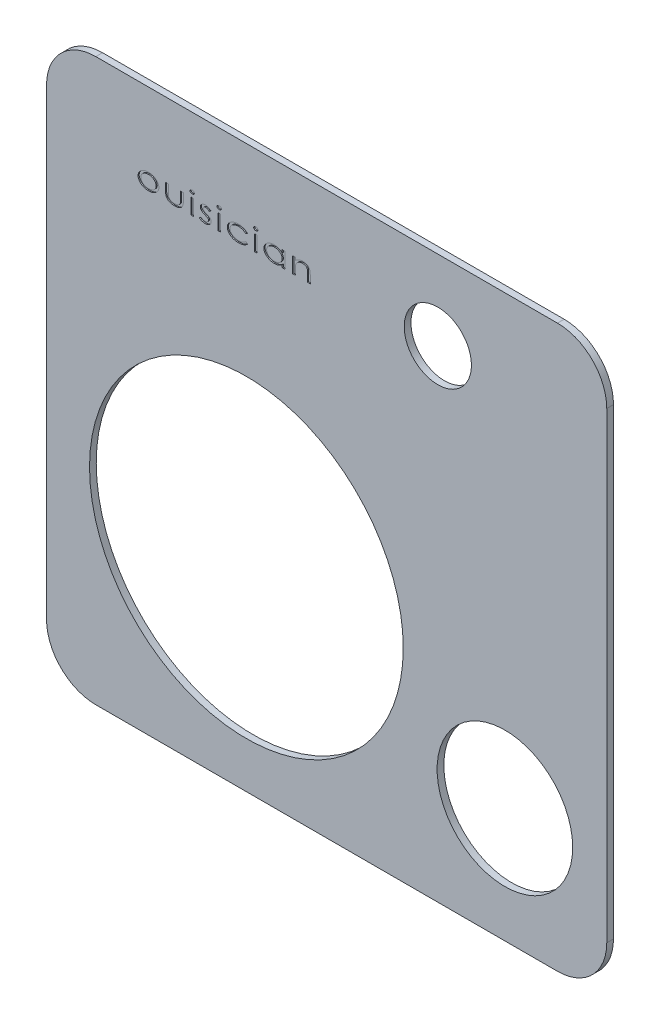
from build123d import *

# Parameters (mm, degrees)
SKETCH1_W           = 500
SKETCH1_H           = 501
BOSS_EXTRUDE1_DEPTH = 6
FILLET1_R           = 44
SKETCH3_R           = 140
CUT_EXTRUDE2_DEPTH  = 708.839671112
SKETCH5_R           = 60.5
CUT_EXTRUDE3_DEPTH  = 708.839671112
SKETCH6_R           = 30
CUT_EXTRUDE5_DEPTH  = 708.839671112
SKETCH7_W           = 2.442307693
SKETCH7_H           = 13.921153846
CUT_EXTRUDE6_DEPTH  = 1


with BuildPart() as part:
    # Sketch1 → Boss-Extrude1 (new body)
    with BuildSketch(Plane.XY):
        with Locations((250, 250.5)):
            Rectangle(SKETCH1_W, SKETCH1_H)
    extrude(amount=BOSS_EXTRUDE1_DEPTH)

    # Fillet1
    fillet1_edges = [part.edges().sort_by_distance(p)[0] for p in [
        (0, 0, 3),
        (500, 0, 3),
        (0, 501, 3),
        (500, 501, 3),
    ]]
    fillet(fillet1_edges, radius=FILLET1_R)

    # Sketch3 → Cut-Extrude2 (cut, through all)
    with BuildSketch(Plane.XY.offset(6)):
        with Locations((178.369044072, 181.034738009)):
            Circle(SKETCH3_R)
    extrude(amount=-CUT_EXTRUDE2_DEPTH, mode=Mode.SUBTRACT)

    # Sketch5 → Cut-Extrude3 (cut, through all)
    with BuildSketch(Plane.XY.offset(6)):
        with Locations((409.103373264, 102.516190165)):
            Circle(SKETCH5_R)
    extrude(amount=-CUT_EXTRUDE3_DEPTH, mode=Mode.SUBTRACT)

    # Sketch6 → Cut-Extrude5 (cut, through all)
    with BuildSketch(Plane.XY.offset(6)):
        with Locations((349.228645131, 430)):
            Circle(SKETCH6_R)
    extrude(amount=-CUT_EXTRUDE5_DEPTH, mode=Mode.SUBTRACT)

    # Sketch7 → Cut-Extrude6 (cut)
    # profile 1 of 12: a face of its own
    with BuildSketch(Plane.XY.offset(6)):
        with BuildLine():
            add(Edge.make_bspline(
                [(90.998016827, 435.165384615), (91.33416584, 435.159759711), (91.993114533, 435.148733283), (92.957647142, 435.033659522), (93.878731764, 434.854379203), (94.758576359, 434.610502452), (95.590807464, 434.281465913), (96.380304595, 433.888600418), (97.127424202, 433.422652341), (97.584251371, 433.055978048), (97.813581731, 432.871905048)],
                knots=[0, 0, 0, 0, 1.097812022, 2.152027136, 3.168404786, 4.161715094, 5.13027777, 6.087458756, 7.039891229, 8, 8, 8, 8], degree=3))
            add(Edge.make_bspline(
                [(97.813581731, 432.871905048), (98.009335824, 432.697597191), (98.392274771, 432.356611897), (98.891710147, 431.793239054), (99.316575043, 431.208138893), (99.66858563, 430.60001305), (99.933961044, 429.962255918), (100.133025282, 429.304789859), (100.249393064, 428.621087473), (100.263850563, 428.156901759), (100.271153846, 427.922415865)],
                knots=[0, 0, 0, 0, 1.100397171, 2.152623868, 3.155292484, 4.134298437, 5.097038208, 6.050627981, 7.015264311, 8, 8, 8, 8], degree=3))
            add(Edge.make_bspline(
                [(100.271153846, 427.922415865), (100.262985923, 427.686557594), (100.246803842, 427.219281241), (100.1202656, 426.531080976), (99.916228441, 425.865485142), (99.63385079, 425.220505043), (99.260671557, 424.60290329), (98.813568578, 424.005599519), (98.279994464, 423.434540306), (97.675345445, 422.891260476), (97.008952386, 422.388722838), (96.285916731, 421.951769806), (95.517972855, 421.581359249), (94.702493985, 421.278996347), (93.842045635, 421.042209306), (92.934251712, 420.875822948), (91.981022296, 420.775452484), (91.330265925, 420.762422035), (90.998016827, 420.755769231)],
                knots=[0, 0, 0, 0, 0.870154496, 1.723927757, 2.573468785, 3.435401244, 4.31551868, 5.231091511, 6.184642541, 7.19533158, 8.228285543, 9.260599047, 10.308491124, 11.370748216, 12.466552481, 13.59834036, 14.773812624, 16, 16, 16, 16], degree=3))
            add(Edge.make_bspline(
                [(90.998016827, 420.755769231), (90.664493287, 420.76241158), (90.011194252, 420.775422478), (89.054210098, 420.875958584), (88.143652313, 421.041541101), (87.281161889, 421.279908639), (86.463621281, 421.580248698), (85.694258277, 421.952957265), (84.96868676, 422.387649146), (84.301792525, 422.890114239), (83.70067732, 423.435825478), (83.167063326, 424.005450714), (82.720132305, 424.602940815), (82.346909523, 425.220495379), (82.064543119, 425.865487666), (81.86050301, 426.531080304), (81.733965548, 427.219281413), (81.717783361, 427.686557652), (81.709615385, 427.922415865)],
                knots=[0, 0, 0, 0, 1.22942661, 2.408175501, 3.543238373, 4.637748882, 5.703147586, 6.749802472, 7.784910086, 8.816644496, 9.822659333, 10.775084556, 11.68957642, 12.568654749, 13.429569571, 14.278107592, 15.130872849, 16, 16, 16, 16], degree=3))
            add(Edge.make_bspline(
                [(81.709615385, 427.922415865), (81.716972911, 428.155627291), (81.731577059, 428.618534746), (81.847825222, 429.300950344), (82.046158974, 429.957402835), (82.311971256, 430.592701804), (82.666655842, 431.197566542), (83.086349343, 431.78522194), (83.590076772, 432.345056297), (83.9717293, 432.685898823), (84.1671875, 432.860456731)],
                knots=[0, 0, 0, 0, 0.981183182, 1.947576142, 2.902902428, 3.862464617, 4.838610501, 5.847446984, 6.897598975, 8, 8, 8, 8], degree=3))
            add(Edge.make_bspline(
                [(84.1671875, 432.860456731), (84.39630701, 433.046103769), (84.852113943, 433.415427217), (85.602419416, 433.880887827), (86.392660465, 434.278984537), (87.228615071, 434.603728856), (88.107303242, 434.856998991), (89.030960896, 435.033027114), (89.999066043, 435.1488953), (90.660580728, 435.159814681), (90.998016827, 435.165384615)],
                knots=[0, 0, 0, 0, 0.960071228, 1.909951369, 2.870129955, 3.839957568, 4.827757854, 5.845479687, 6.900987469, 8, 8, 8, 8], degree=3))
        make_face()
        with BuildLine():
            add(Edge.make_bspline(
                [(90.990384615, 433.455769231), (90.759931849, 433.450534468), (90.306646767, 433.440238042), (89.64046147, 433.36208309), (88.999836122, 433.236197517), (88.382251754, 433.061361552), (87.789245332, 432.830524905), (87.219390762, 432.551855546), (86.673969115, 432.222837228), (86.164894592, 431.842263665), (85.69325583, 431.433077107), (85.283557682, 430.991387268), (84.93262996, 430.533101523), (84.646505842, 430.050473451), (84.42372951, 429.545827573), (84.268203184, 429.018546278), (84.167633357, 428.471957182), (84.157207759, 428.099675328), (84.151923077, 427.910967548)],
                knots=[0, 0, 0, 0, 1.133104166, 2.22873964, 3.293620265, 4.341068313, 5.380791823, 6.418726033, 7.457225619, 8.508179592, 9.540954667, 10.523576707, 11.465678478, 12.37437369, 13.276304193, 14.170872231, 15.072824428, 16, 16, 16, 16], degree=3))
            add(Edge.make_bspline(
                [(84.151923077, 427.910967548), (84.155224854, 427.788754215), (84.161812992, 427.544898117), (84.203563195, 427.182056165), (84.27802016, 426.825417895), (84.375836595, 426.473674907), (84.506467584, 426.129048632), (84.667762202, 425.793044678), (84.856553019, 425.463651622), (85.139556463, 425.031143776), (85.560922859, 424.528710787), (86.143748335, 423.98772249), (86.815372426, 423.530239678), (87.556141514, 423.145742934), (88.355565894, 422.841830349), (89.200613846, 422.626346086), (90.082575005, 422.486306984), (90.684554834, 422.472433101), (90.990384615, 422.465384615)],
                knots=[0, 0, 0, 0, 0.604394602, 1.205967522, 1.803051029, 2.404426593, 3.009606293, 3.622968857, 4.245583361, 4.885868639, 6.176917373, 7.476808435, 8.806374189, 10.182172105, 11.595745519, 13.025309634, 14.488738556, 16, 16, 16, 16], degree=3))
            add(Edge.make_bspline(
                [(90.990384615, 422.465384615), (91.296214397, 422.472433101), (91.898194226, 422.486306984), (92.780155384, 422.626346086), (93.625203337, 422.841830349), (94.424627717, 423.145742934), (95.165396804, 423.530239678), (95.837020896, 423.98772249), (96.419846372, 424.528710787), (96.841212768, 425.031143776), (97.124216212, 425.463651622), (97.313007029, 425.793044678), (97.474301647, 426.129048632), (97.604932636, 426.473674907), (97.702749071, 426.825417895), (97.777206036, 427.182056165), (97.818956239, 427.544898117), (97.825544377, 427.788754215), (97.828846154, 427.910967548)],
                knots=[0, 0, 0, 0, 1.511261444, 2.974690366, 4.404254481, 5.817827895, 7.193625811, 8.523191565, 9.823082627, 11.114131361, 11.754416639, 12.377031143, 12.990393707, 13.595573407, 14.196948971, 14.794032478, 15.395605398, 16, 16, 16, 16], degree=3))
            add(Edge.make_bspline(
                [(97.828846154, 427.910967548), (97.823452117, 428.099642599), (97.812810784, 428.471859884), (97.713755046, 429.019286123), (97.55211788, 429.545126634), (97.330631709, 430.050461339), (97.044469717, 430.534191041), (96.689373839, 430.991480617), (96.276061842, 431.431800742), (95.80425835, 431.843696561), (95.291927228, 432.221694495), (94.747024468, 432.551047596), (94.180153014, 432.830509923), (93.589871882, 433.062042926), (92.97326866, 433.23612774), (92.3339133, 433.361749711), (91.670324915, 433.440292096), (91.219569094, 433.450552421), (90.990384615, 433.455769231)],
                knots=[0, 0, 0, 0, 0.927697335, 1.8301571, 2.727043116, 3.629481175, 4.53868775, 5.485114823, 6.472564047, 7.50592031, 8.562501804, 9.6015858, 10.634487024, 11.668961074, 12.716998568, 13.782478447, 14.872512573, 16, 16, 16, 16], degree=3))
        make_face(mode=Mode.SUBTRACT)
    # profile 2 of 12: a face of its own
    with BuildSketch(Plane.XY.offset(6)):
        with BuildLine():
            Line((106.230384615, 434.921153846), (108.672692308, 434.921153846))
            Line((108.672692308, 434.921153846), (108.672692308, 428.464302885))
            add(Edge.make_bspline(
                [(108.672692308, 428.464302885), (108.67304883, 428.274758065), (108.673730903, 427.912134977), (108.689179922, 427.390435007), (108.71483796, 426.914440569), (108.752763418, 426.48432833), (108.799227595, 426.100114671), (108.848337784, 425.761383245), (108.917599286, 425.468541446), (108.974426823, 425.291547247), (109.000877404, 425.209164663)],
                knots=[0, 0, 0, 0, 1.385077091, 2.649826742, 3.813598512, 4.868107529, 5.804337452, 6.641819815, 7.36783017, 8, 8, 8, 8], degree=3))
            add(Edge.make_bspline(
                [(109.000877404, 425.209164663), (109.044396837, 425.105013689), (109.131457854, 424.89665873), (109.302351854, 424.605330313), (109.49296631, 424.324528659), (109.720840579, 424.068626446), (109.968064185, 423.820383849), (110.249733903, 423.596945348), (110.554561365, 423.385778183), (110.887454185, 423.196455381), (111.241314974, 423.02415608), (111.616312247, 422.877608341), (112.004793861, 422.745441215), (112.412263948, 422.643536904), (112.835357602, 422.56362575), (113.276208104, 422.506717165), (113.733549443, 422.471746404), (114.044434162, 422.467526505), (114.202229567, 422.465384615)],
                knots=[0, 0, 0, 0, 0.866612738, 1.733666556, 2.590685396, 3.470868852, 4.362703729, 5.280369739, 6.229525244, 7.210572352, 8.220662861, 9.251871877, 10.303048293, 11.372479967, 12.476955404, 13.610811224, 14.787322159, 16, 16, 16, 16], degree=3))
            add(Edge.make_bspline(
                [(114.202229567, 422.465384615), (114.360047034, 422.467321614), (114.668437768, 422.471106697), (115.121529256, 422.508412125), (115.558051177, 422.558263522), (115.975214872, 422.640541518), (116.376725011, 422.73760143), (116.756598145, 422.865485943), (117.121193965, 423.008919171), (117.464616192, 423.178005547), (117.785912311, 423.362768316), (118.084379061, 423.562646818), (118.353661803, 423.779894427), (118.599121729, 424.009015161), (118.819786565, 424.251982321), (119.013477372, 424.509527551), (119.179929009, 424.783717686), (119.270404247, 424.975523005), (119.315811298, 425.071784856)],
                knots=[0, 0, 0, 0, 1.247675426, 2.438079564, 3.593415261, 4.71988351, 5.798211008, 6.857462447, 7.88667594, 8.894380439, 9.881286462, 10.815903603, 11.731765806, 12.614206242, 13.468803136, 14.323814323, 15.158768193, 16, 16, 16, 16], degree=3))
            add(Edge.make_bspline(
                [(119.315811298, 425.071784856), (119.343772918, 425.147698715), (119.405340224, 425.314849678), (119.476730526, 425.599550008), (119.530071073, 425.940878789), (119.5804617, 426.337785098), (119.617199664, 426.79110054), (119.641939384, 427.300193793), (119.663410407, 427.863728416), (119.663191362, 428.258209148), (119.663076923, 428.464302885)],
                knots=[0, 0, 0, 0, 0.566488682, 1.247323346, 2.051625098, 2.985625027, 4.049821468, 5.236680496, 6.55632279, 8, 8, 8, 8], degree=3))
            Line((119.663076923, 428.464302885), (119.663076923, 434.921153846))
            Line((119.663076923, 434.921153846), (122.105384615, 434.921153846))
            Line((122.105384615, 434.921153846), (122.105384615, 428.14375))
            add(Edge.make_bspline(
                [(122.105384615, 428.14375), (122.10188359, 427.913473618), (122.095089428, 427.46659457), (122.059102897, 426.816810981), (121.990445822, 426.21183682), (121.89664572, 425.64919923), (121.770629204, 425.133428868), (121.623724758, 424.658446652), (121.443720876, 424.229647499), (121.236609016, 423.839962269), (120.9990053, 423.485020596), (120.738952038, 423.15197922), (120.451735425, 422.836864157), (120.13363067, 422.544017657), (119.79071582, 422.267783774), (119.416733508, 422.01711793), (119.02051862, 421.777890149), (118.592199109, 421.565635423), (118.136961426, 421.375301021), (117.655354507, 421.204614588), (117.143608619, 421.071335258), (116.605290427, 420.955061697), (116.039728501, 420.864501807), (115.444977191, 420.799930907), (114.82350722, 420.761223008), (114.399451428, 420.757611426), (114.183149038, 420.755769231)],
                knots=[0, 0, 0, 0, 1.327493148, 2.576160298, 3.749463019, 4.83557823, 5.861724984, 6.807863683, 7.698474281, 8.538253159, 9.347648041, 10.157308583, 10.972132152, 11.802284539, 12.647392361, 13.507664376, 14.395463419, 15.313628384, 16.260079569, 17.238676909, 18.256062574, 19.305906206, 20.412519666, 21.555860972, 22.753293505, 24, 24, 24, 24], degree=3))
            add(Edge.make_bspline(
                [(114.183149038, 420.755769231), (113.966846296, 420.757609672), (113.542789811, 420.761217815), (112.921324803, 420.799950352), (112.326555797, 420.864433403), (111.759827373, 420.95550049), (111.218890889, 421.071303579), (110.703357091, 421.20462846), (110.217947609, 421.375324522), (109.758843809, 421.56556743), (109.326943065, 421.778130381), (108.925523545, 422.01660401), (108.550740752, 422.271149014), (108.204505771, 422.547512404), (107.887831793, 422.845874707), (107.596887939, 423.163375914), (107.332574978, 423.49918716), (107.095924088, 423.859441096), (106.886206517, 424.252546491), (106.713093959, 424.693011378), (106.560142763, 425.175702663), (106.439395048, 425.70698293), (106.345797763, 426.281877458), (106.276277334, 426.903320211), (106.24070314, 427.570917129), (106.233897734, 428.031775198), (106.230384615, 428.26968149)],
                knots=[0, 0, 0, 0, 1.232259487, 2.415816005, 3.545908112, 4.639697982, 5.684463563, 6.697060633, 7.671163045, 8.61333243, 9.52734564, 10.411089718, 11.271463884, 12.106778478, 12.932257128, 13.747877815, 14.558330161, 15.364395943, 16.200841634, 17.09177784, 18.056778823, 19.083464923, 20.192728377, 21.374041605, 22.644415561, 24, 24, 24, 24], degree=3))
            Line((106.230384615, 428.26968149), (106.230384615, 434.921153846))
        make_face()
    # profile 3 of 12: a face of its own
    with BuildSketch(Plane.XY.offset(6)):
        with BuildLine():
            add(Edge.make_bspline(
                [(130.010829327, 440.782692308), (130.142275672, 440.777937971), (130.396357018, 440.768748), (130.76327945, 440.686757813), (131.097698684, 440.547623283), (131.396736208, 440.362412802), (131.651360243, 440.142140023), (131.833210732, 439.884784611), (131.955432976, 439.606151579), (131.966662641, 439.408854792), (131.972307692, 439.309675481)],
                knots=[0, 0, 0, 0, 1.162518104, 2.247108227, 3.30734103, 4.354153766, 5.351019781, 6.263407083, 7.127030435, 8, 8, 8, 8], degree=3))
            add(Edge.make_bspline(
                [(131.972307692, 439.309675481), (131.966499241, 439.213063095), (131.954864551, 439.019542472), (131.833188079, 438.745712049), (131.650028987, 438.492215413), (131.396896141, 438.272078398), (131.09765438, 438.087026503), (130.763291605, 437.947848133), (130.396353693, 437.865869967), (130.142274539, 437.856678294), (130.010829327, 437.851923077)],
                knots=[0, 0, 0, 0, 0.855086126, 1.712790746, 2.620787936, 3.622906021, 4.675233975, 5.741052701, 6.831357075, 8, 8, 8, 8], degree=3))
            add(Edge.make_bspline(
                [(130.010829327, 437.851923077), (129.881915107, 437.856716122), (129.631600287, 437.866022855), (129.268734697, 437.948559671), (128.93535211, 438.086906264), (128.636532447, 438.272322218), (128.382561323, 438.49094553), (128.204245252, 438.746985149), (128.081859472, 439.019399786), (128.070357552, 439.213015582), (128.064615385, 439.309675481)],
                knots=[0, 0, 0, 0, 1.151846764, 2.236559441, 3.307763338, 4.3654083, 5.372589701, 6.278555182, 7.140593453, 8, 8, 8, 8], degree=3))
            add(Edge.make_bspline(
                [(128.064615385, 439.309675481), (128.070191716, 439.408903308), (128.081284678, 439.606296605), (128.204241083, 439.883517896), (128.381225954, 440.143392482), (128.636691086, 440.362173241), (128.93530815, 440.547742354), (129.268746625, 440.686046697), (129.631597072, 440.76859496), (129.881914014, 440.777900089), (130.010829327, 440.782692308)],
                knots=[0, 0, 0, 0, 0.877349818, 1.745306527, 2.655753819, 3.657621755, 4.709687028, 5.775239705, 6.854229894, 8, 8, 8, 8], degree=3))
        make_face()
    # profile 4 of 12: a face of its own
    with BuildSketch(Plane.XY.offset(6)):
        with Locations((130.018461538, 427.960576923)):
            Rectangle(SKETCH7_W, SKETCH7_H)
    # profile 5 of 12: a face of its own
    with BuildSketch(Plane.XY.offset(6)):
        with BuildLine():
            Line((146.723846154, 433.184825721), (145.243197115, 431.990384615))
            add(Edge.make_bspline(
                [(145.243197115, 431.990384615), (145.108628672, 432.106763221), (144.847395732, 432.332684874), (144.441444074, 432.630615625), (144.039666988, 432.885467943), (143.637692732, 433.093193211), (143.23744572, 433.253614732), (142.840393482, 433.37029618), (142.444806594, 433.442307965), (142.180425116, 433.451302151), (142.049116587, 433.455769231)],
                knots=[0, 0, 0, 0, 1.187891683, 2.306011931, 3.359687364, 4.362827326, 5.323627033, 6.235078112, 7.123428389, 8, 8, 8, 8], degree=3))
            add(Edge.make_bspline(
                [(142.049116587, 433.455769231), (141.88943601, 433.449945771), (141.577709682, 433.438577291), (141.128995906, 433.326872444), (140.713267851, 433.150766049), (140.345337389, 432.905062278), (140.038258864, 432.616440153), (139.805822686, 432.29831267), (139.669043675, 431.947304627), (139.650466068, 431.704013529), (139.641153846, 431.582061298)],
                knots=[0, 0, 0, 0, 1.136790661, 2.219227826, 3.275698873, 4.342400822, 5.356146276, 6.26721311, 7.131422276, 8, 8, 8, 8], degree=3))
            add(Edge.make_bspline(
                [(139.641153846, 431.582061298), (139.648072393, 431.471452953), (139.662070966, 431.247654641), (139.794066286, 430.924230965), (139.985155852, 430.604175005), (140.164740257, 430.417361836), (140.259362981, 430.318930288)],
                knots=[0, 0, 0, 0, 0.915738981, 1.852851503, 2.868671037, 4, 4, 4, 4], degree=3))
            add(Edge.make_bspline(
                [(140.259362981, 430.318930288), (140.316841401, 430.265517349), (140.440363823, 430.150731739), (140.66312168, 429.993460246), (140.920459986, 429.820508005), (141.225172814, 429.645990606), (141.570115779, 429.464031564), (141.959672002, 429.277397098), (142.388201797, 429.078072731), (142.692309228, 428.950457156), (142.850498798, 428.884074519)],
                knots=[0, 0, 0, 0, 0.632188666, 1.358587701, 2.195162106, 3.133051463, 4.188584517, 5.34030249, 6.616487589, 8, 8, 8, 8], degree=3))
            add(Edge.make_bspline(
                [(142.850498798, 428.884074519), (143.04296664, 428.801013778), (143.414650097, 428.640611379), (143.945604946, 428.39429755), (144.426097499, 428.145980586), (144.860029442, 427.902099996), (145.244949252, 427.659060334), (145.583279447, 427.417959056), (145.875366745, 427.180598894), (146.042124055, 427.010557281), (146.120901442, 426.930228365)],
                knots=[0, 0, 0, 0, 1.312067257, 2.53379313, 3.662611409, 4.696582447, 5.648584007, 6.510270476, 7.296240754, 8, 8, 8, 8], degree=3))
            add(Edge.make_bspline(
                [(146.120901442, 426.930228365), (146.250410726, 426.770307261), (146.503368843, 426.457948639), (146.773683212, 425.925723143), (146.937354613, 425.361293915), (146.957770095, 424.973648741), (146.968076923, 424.777944712)],
                knots=[0, 0, 0, 0, 1.042010882, 2.035260359, 3.008094284, 4, 4, 4, 4], degree=3))
            add(Edge.make_bspline(
                [(146.968076923, 424.777944712), (146.964160216, 424.640212988), (146.956415343, 424.367863096), (146.879962019, 423.968350848), (146.762725852, 423.584773686), (146.595269524, 423.217216054), (146.381649227, 422.864953358), (146.114371419, 422.532222976), (145.803257715, 422.214685535), (145.450235365, 421.914599027), (145.060996691, 421.643924393), (144.645927454, 421.403850568), (144.203991097, 421.205784778), (143.738878897, 421.043085138), (143.250886535, 420.911079666), (142.738780109, 420.821021467), (142.202918307, 420.767203493), (141.838084999, 420.759628087), (141.652241587, 420.755769231)],
                knots=[0, 0, 0, 0, 0.892205618, 1.764242088, 2.627811223, 3.487946356, 4.376330948, 5.292242552, 6.248848694, 7.255361655, 8.291945272, 9.319133229, 10.360170501, 11.427157011, 12.511599973, 13.634479513, 14.795021201, 16, 16, 16, 16], degree=3))
            add(Edge.make_bspline(
                [(141.652241587, 420.755769231), (141.401325968, 420.761150339), (140.9040019, 420.771815894), (140.167509533, 420.872072852), (139.448568694, 421.027432213), (138.753452925, 421.243527882), (138.09583852, 421.515382218), (137.491610634, 421.84054419), (136.942403927, 422.208409779), (136.623218349, 422.498284321), (136.466153846, 422.640925481)],
                knots=[0, 0, 0, 0, 1.065567263, 2.111993857, 3.151924496, 4.187816772, 5.200540087, 6.170180221, 7.099584209, 8, 8, 8, 8], degree=3))
            Line((136.466153846, 422.640925481), (137.912457933, 423.930769231))
            add(Edge.make_bspline(
                [(137.912457933, 423.930769231), (138.049401765, 423.814141274), (138.31698632, 423.58625339), (138.739286411, 423.287234694), (139.167745402, 423.033568285), (139.604428976, 422.82608708), (140.047956837, 422.665218183), (140.49765394, 422.549894119), (140.95288379, 422.47866515), (141.2589323, 422.469808959), (141.411826923, 422.465384615)],
                knots=[0, 0, 0, 0, 1.111927383, 2.17267613, 3.195288797, 4.187559573, 5.158013992, 6.108138625, 7.054870644, 8, 8, 8, 8], degree=3))
            add(Edge.make_bspline(
                [(141.411826923, 422.465384615), (141.619890822, 422.472826451), (142.024802502, 422.487308954), (142.606413862, 422.617658046), (143.142957818, 422.822298186), (143.541873457, 423.070291073), (143.82465384, 423.299002153), (144.015490095, 423.473508321), (144.172511869, 423.661343189), (144.298588345, 423.857235792), (144.399742655, 424.057631559), (144.47428417, 424.266031474), (144.515814487, 424.483732734), (144.522449345, 424.631500227), (144.525769231, 424.705438702)],
                knots=[0, 0, 0, 0, 1.769049331, 3.442734361, 5.047389919, 6.63714271, 7.415058499, 8.142822723, 8.83465713, 9.492434366, 10.121975348, 10.74185, 11.370459018, 12, 12, 12, 12], degree=3))
            add(Edge.make_bspline(
                [(144.525769231, 424.705438702), (144.518589932, 424.827239828), (144.504280678, 425.070004948), (144.382682589, 425.420139458), (144.18808649, 425.749184081), (144.008453161, 425.936298614), (143.915192308, 426.03344351)],
                knots=[0, 0, 0, 0, 0.970537225, 1.934404011, 2.927597426, 4, 4, 4, 4], degree=3))
            add(Edge.make_bspline(
                [(143.915192308, 426.03344351), (143.857478859, 426.08281122), (143.730269214, 426.191625526), (143.502295165, 426.345603239), (143.229305301, 426.511416708), (142.90957287, 426.689310501), (142.540153261, 426.869551374), (142.122330299, 427.06059262), (141.657553479, 427.261946059), (141.33061169, 427.397530684), (141.159963942, 427.468299279)],
                knots=[0, 0, 0, 0, 0.584112892, 1.287477956, 2.113538331, 3.042533919, 4.102045882, 5.276041122, 6.578225652, 8, 8, 8, 8], degree=3))
            add(Edge.make_bspline(
                [(141.159963942, 427.468299279), (140.974888583, 427.547022059), (140.618588464, 427.698576193), (140.112737184, 427.940851347), (139.65230236, 428.180609063), (139.234749093, 428.414593383), (138.866531445, 428.65350503), (138.541352056, 428.886970822), (138.264158897, 429.124522811), (138.103428064, 429.289982618), (138.026941106, 429.368719952)],
                knots=[0, 0, 0, 0, 1.307990047, 2.518093226, 3.646744414, 4.68422955, 5.629722174, 6.500166002, 7.286274211, 8, 8, 8, 8], degree=3))
            add(Edge.make_bspline(
                [(138.026941106, 429.368719952), (137.899583678, 429.525931958), (137.649407773, 429.834753019), (137.390801903, 430.365999149), (137.229391014, 430.928979565), (137.209142808, 431.316373266), (137.198846154, 431.513371394)],
                knots=[0, 0, 0, 0, 1.030481179, 2.024236566, 2.995281297, 4, 4, 4, 4], degree=3))
            add(Edge.make_bspline(
                [(137.198846154, 431.513371394), (137.201583677, 431.6421907), (137.206960452, 431.895205009), (137.277097059, 432.264460354), (137.377416385, 432.619720207), (137.528901436, 432.955320929), (137.717508039, 433.275812463), (137.948718775, 433.579932737), (138.224562285, 433.864562947), (138.537865553, 434.131231943), (138.881954837, 434.374181038), (139.254097465, 434.583196948), (139.645558113, 434.764002372), (140.058818934, 434.913439691), (140.495680672, 435.028035421), (140.955494367, 435.106084144), (141.436073409, 435.158081049), (141.764039624, 435.16292259), (141.930817308, 435.165384615)],
                knots=[0, 0, 0, 0, 0.926970618, 1.820665221, 2.699569755, 3.581909386, 4.465438636, 5.374792027, 6.327820406, 7.316125139, 8.33593867, 9.358097786, 10.387588118, 11.440163339, 12.520745957, 13.63746689, 14.798602476, 16, 16, 16, 16], degree=3))
            add(Edge.make_bspline(
                [(141.930817308, 435.165384615), (142.1295673, 435.159294322), (142.53039937, 435.14701163), (143.130696064, 435.053055289), (143.730290421, 434.893447596), (144.33062339, 434.675258452), (144.932036704, 434.393482642), (145.534542597, 434.053651495), (146.138077188, 433.650548912), (146.525022778, 433.342902817), (146.723846154, 433.184825721)],
                knots=[0, 0, 0, 0, 0.90139979, 1.817911729, 2.748700527, 3.712549689, 4.711683986, 5.758141166, 6.848070756, 8, 8, 8, 8], degree=3))
        make_face()
    # profile 6 of 12: a face of its own
    with BuildSketch(Plane.XY.offset(6)):
        with BuildLine():
            add(Edge.make_bspline(
                [(154.140829327, 440.782692308), (154.272275672, 440.777937971), (154.526357018, 440.768748), (154.89327945, 440.686757813), (155.227698684, 440.547623283), (155.526736208, 440.362412802), (155.781360243, 440.142140023), (155.963210732, 439.884784611), (156.085432976, 439.606151579), (156.096662641, 439.408854792), (156.102307692, 439.309675481)],
                knots=[0, 0, 0, 0, 1.162518104, 2.247108227, 3.30734103, 4.354153766, 5.351019781, 6.263407083, 7.127030435, 8, 8, 8, 8], degree=3))
            add(Edge.make_bspline(
                [(156.102307692, 439.309675481), (156.096499241, 439.213063095), (156.084864551, 439.019542472), (155.963188079, 438.745712049), (155.780028987, 438.492215413), (155.526896141, 438.272078398), (155.22765438, 438.087026503), (154.893291605, 437.947848133), (154.526353693, 437.865869967), (154.272274539, 437.856678294), (154.140829327, 437.851923077)],
                knots=[0, 0, 0, 0, 0.855086126, 1.712790746, 2.620787936, 3.622906021, 4.675233975, 5.741052701, 6.831357075, 8, 8, 8, 8], degree=3))
            add(Edge.make_bspline(
                [(154.140829327, 437.851923077), (154.011915107, 437.856716122), (153.761600287, 437.866022855), (153.398734697, 437.948559671), (153.06535211, 438.086906264), (152.766532447, 438.272322218), (152.512561323, 438.49094553), (152.334245252, 438.746985149), (152.211859472, 439.019399786), (152.200357552, 439.213015582), (152.194615385, 439.309675481)],
                knots=[0, 0, 0, 0, 1.151846764, 2.236559441, 3.307763338, 4.3654083, 5.372589701, 6.278555182, 7.140593453, 8, 8, 8, 8], degree=3))
            add(Edge.make_bspline(
                [(152.194615385, 439.309675481), (152.200191716, 439.408903308), (152.211284678, 439.606296605), (152.334241083, 439.883517896), (152.511225954, 440.143392482), (152.766691086, 440.362173241), (153.06530815, 440.547742354), (153.398746625, 440.686046697), (153.761597072, 440.76859496), (154.011914014, 440.777900089), (154.140829327, 440.782692308)],
                knots=[0, 0, 0, 0, 0.877349818, 1.745306527, 2.655753819, 3.657621755, 4.709687028, 5.775239705, 6.854229894, 8, 8, 8, 8], degree=3))
        make_face()
    # profile 7 of 12: a face of its own
    with BuildSketch(Plane.XY.offset(6)):
        with Locations((154.148461538, 427.960576923)):
            Rectangle(SKETCH7_W, SKETCH7_H)
    # profile 8 of 12: a face of its own
    with BuildSketch(Plane.XY.offset(6)):
        with BuildLine():
            Line((179.646153846, 431.902614183), (177.818239183, 431.013461538))
            add(Edge.make_bspline(
                [(177.818239183, 431.013461538), (177.616463475, 431.209191833), (177.214716671, 431.598901878), (176.534857698, 432.096073331), (175.803439979, 432.516570304), (175.018283836, 432.862996456), (174.179774658, 433.128648407), (173.287892021, 433.318953468), (172.342659801, 433.435166006), (171.693727947, 433.448791275), (171.361388221, 433.455769231)],
                knots=[0, 0, 0, 0, 0.9494826, 1.890473355, 2.83836709, 3.797269736, 4.786037081, 5.806678462, 6.876726617, 8, 8, 8, 8], degree=3))
            add(Edge.make_bspline(
                [(171.361388221, 433.455769231), (171.094116797, 433.450148963), (170.571297039, 433.439154944), (169.803106282, 433.36738343), (169.07159153, 433.24047387), (168.371311289, 433.070212975), (167.707255395, 432.845447982), (167.079181101, 432.568365173), (166.482728148, 432.248628267), (165.931296905, 431.875181611), (165.425332792, 431.472348195), (164.984520779, 431.039777262), (164.609021152, 430.5876644), (164.306048295, 430.110959886), (164.06630352, 429.614455729), (163.89188632, 429.095997531), (163.791715707, 428.553396873), (163.778053395, 428.184854224), (163.771153846, 427.998737981)],
                knots=[0, 0, 0, 0, 1.238220852, 2.42213071, 3.570180525, 4.675007234, 5.757735811, 6.813227596, 7.852154922, 8.888387926, 9.894317433, 10.84442819, 11.744594942, 12.611028748, 13.4544716, 14.293062589, 15.137986393, 16, 16, 16, 16], degree=3))
            add(Edge.make_bspline(
                [(163.771153846, 427.998737981), (163.774173618, 427.87650142), (163.780202841, 427.63244609), (163.826414017, 427.268033372), (163.907917263, 426.911448671), (164.014761672, 426.558205723), (164.157394606, 426.213777907), (164.325277393, 425.870371783), (164.528404494, 425.535555355), (164.761373163, 425.208561131), (165.018919627, 424.891179701), (165.307530423, 424.595594756), (165.612123721, 424.311237301), (165.941931043, 424.046388761), (166.296961857, 423.804452903), (166.672697281, 423.576185969), (167.074033991, 423.373325661), (167.637366155, 423.114658241), (168.388361176, 422.851171428), (169.338714115, 422.627116485), (170.3411086, 422.491148963), (171.026413387, 422.474098572), (171.376652644, 422.465384615)],
                knots=[0, 0, 0, 0, 0.703448363, 1.404492419, 2.109653125, 2.806710023, 3.525907214, 4.252777145, 5.00487144, 5.776801811, 6.562360393, 7.354577522, 8.152424161, 8.959654607, 9.786176278, 10.623650001, 11.488082903, 12.372711049, 14.190457285, 16.056797813, 17.984744556, 20, 20, 20, 20], degree=3))
            add(Edge.make_bspline(
                [(171.376652644, 422.465384615), (171.698841389, 422.472310415), (172.328801913, 422.485852105), (173.250876926, 422.603728641), (174.127754821, 422.792604008), (174.960165477, 423.060514825), (175.747296935, 423.404710654), (176.487329863, 423.828993337), (177.187966428, 424.322251154), (177.607431052, 424.71187906), (177.818239183, 424.907692308)],
                knots=[0, 0, 0, 0, 1.093058425, 2.137205815, 3.149093137, 4.13342061, 5.099941104, 6.058950921, 7.024497173, 8, 8, 8, 8], degree=3))
            Line((177.818239183, 424.907692308), (179.646153846, 423.968930288))
            add(Edge.make_bspline(
                [(179.646153846, 423.968930288), (179.536045182, 423.843800775), (179.314149189, 423.591634084), (178.946512602, 423.243953894), (178.556389212, 422.912098501), (178.133850866, 422.607176984), (177.685100181, 422.322104138), (177.208409271, 422.057378457), (176.705459459, 421.813388284), (176.17492945, 421.593196648), (175.622571805, 421.394562369), (175.049236329, 421.22299936), (174.458105457, 421.078607349), (173.848217457, 420.959648985), (173.219041554, 420.868304909), (172.570752416, 420.805857249), (171.903932229, 420.759867265), (171.45305761, 420.757149755), (171.224008413, 420.755769231)],
                knots=[0, 0, 0, 0, 0.860018317, 1.733148069, 2.609235921, 3.502384109, 4.420505129, 5.352331597, 6.315625453, 7.304649951, 8.316176708, 9.34452958, 10.392486919, 11.456228468, 12.551111855, 13.672994075, 14.817855754, 16, 16, 16, 16], degree=3))
            add(Edge.make_bspline(
                [(171.224008413, 420.755769231), (170.87519616, 420.760630704), (170.19135258, 420.770161583), (169.189586881, 420.874379486), (168.233504377, 421.030533673), (167.32281303, 421.258043278), (166.456278922, 421.545614524), (165.635398275, 421.902413074), (164.860847741, 422.322969492), (164.141397922, 422.806024942), (163.483155818, 423.328801201), (162.912797632, 423.893833331), (162.421277402, 424.479060575), (162.019265874, 425.096653648), (161.714430178, 425.746786448), (161.487840592, 426.420478834), (161.356629112, 427.124857594), (161.338176519, 427.60388063), (161.328846154, 427.84609375)],
                knots=[0, 0, 0, 0, 1.240348237, 2.431692603, 3.578767869, 4.683897599, 5.767086738, 6.822899822, 7.863663898, 8.897767126, 9.901946174, 10.849043619, 11.748780218, 12.616061319, 13.462118978, 14.296332513, 15.138557887, 16, 16, 16, 16], degree=3))
            add(Edge.make_bspline(
                [(161.328846154, 427.84609375), (161.33164837, 428.0104617), (161.337231874, 428.337970071), (161.408997866, 428.823128218), (161.502735878, 429.302516524), (161.652867897, 429.76909962), (161.833855007, 430.230779678), (162.066167303, 430.678049256), (162.32902325, 431.122434333), (162.639545796, 431.549197563), (162.979253879, 431.966415166), (163.361597782, 432.353197645), (163.764075994, 432.727687252), (164.205605941, 433.068091791), (164.672575682, 433.392183447), (165.172849643, 433.687193548), (165.701783635, 433.96442585), (166.260574219, 434.213842531), (166.842514661, 434.438535186), (167.443706523, 434.63373098), (168.06282616, 434.798225557), (168.700309634, 434.929478861), (169.352818221, 435.039374843), (170.023351183, 435.108368567), (170.709384472, 435.157177359), (171.173037193, 435.162630688), (171.40718149, 435.165384615)],
                knots=[0, 0, 0, 0, 0.856107378, 1.705821189, 2.552501917, 3.399883552, 4.256966376, 5.134834285, 6.024198899, 6.946193713, 7.883585536, 8.826217102, 9.779057133, 10.74746224, 11.729732201, 12.740793126, 13.773010902, 14.841590098, 15.92903673, 17.02373846, 18.135243946, 19.266767217, 20.415857255, 21.583191723, 22.779513524, 24, 24, 24, 24], degree=3))
            add(Edge.make_bspline(
                [(171.40718149, 435.165384615), (171.702493048, 435.160428662), (172.289120434, 435.150583813), (173.159237987, 435.066314117), (174.015298331, 434.939452022), (174.84648643, 434.75149307), (175.640117402, 434.525605816), (176.380642007, 434.267412605), (177.056757181, 433.974176675), (177.674574688, 433.648556089), (178.238119677, 433.282259197), (178.756294734, 432.873167646), (179.229331086, 432.413570755), (179.506871615, 432.073351432), (179.646153846, 431.902614183)],
                knots=[0, 0, 0, 0, 1.160203264, 2.304708337, 3.432278024, 4.558916641, 5.650627656, 6.673486115, 7.638332717, 8.543962861, 9.414652643, 10.275718857, 11.134678723, 12, 12, 12, 12], degree=3))
        make_face()
    # profile 9 of 12: a face of its own
    with BuildSketch(Plane.XY.offset(6)):
        with BuildLine():
            add(Edge.make_bspline(
                [(186.81890625, 440.782692308), (186.950352595, 440.777937971), (187.204433941, 440.768748), (187.571356373, 440.686757813), (187.905775607, 440.547623283), (188.204813131, 440.362412802), (188.459437166, 440.142140023), (188.641287656, 439.884784611), (188.763509899, 439.606151579), (188.774739564, 439.408854792), (188.780384615, 439.309675481)],
                knots=[0, 0, 0, 0, 1.162518104, 2.247108227, 3.30734103, 4.354153766, 5.351019781, 6.263407083, 7.127030435, 8, 8, 8, 8], degree=3))
            add(Edge.make_bspline(
                [(188.780384615, 439.309675481), (188.774576164, 439.213063095), (188.762941474, 439.019542472), (188.641265002, 438.745712049), (188.45810591, 438.492215413), (188.204973064, 438.272078398), (187.905731303, 438.087026503), (187.571368528, 437.947848133), (187.204430616, 437.865869967), (186.950351462, 437.856678294), (186.81890625, 437.851923077)],
                knots=[0, 0, 0, 0, 0.855086126, 1.712790746, 2.620787936, 3.622906021, 4.675233975, 5.741052701, 6.831357075, 8, 8, 8, 8], degree=3))
            add(Edge.make_bspline(
                [(186.81890625, 437.851923077), (186.68999203, 437.856716122), (186.43967721, 437.866022855), (186.07681162, 437.948559671), (185.743429033, 438.086906264), (185.44460937, 438.272322218), (185.190638246, 438.49094553), (185.012322175, 438.746985149), (184.889936395, 439.019399786), (184.878434475, 439.213015582), (184.872692308, 439.309675481)],
                knots=[0, 0, 0, 0, 1.151846764, 2.236559441, 3.307763338, 4.3654083, 5.372589701, 6.278555182, 7.140593453, 8, 8, 8, 8], degree=3))
            add(Edge.make_bspline(
                [(184.872692308, 439.309675481), (184.878268639, 439.408903308), (184.889361601, 439.606296605), (185.012318006, 439.883517896), (185.189302877, 440.143392482), (185.444768009, 440.362173241), (185.743385073, 440.547742354), (186.076823548, 440.686046697), (186.439673995, 440.76859496), (186.689990937, 440.777900089), (186.81890625, 440.782692308)],
                knots=[0, 0, 0, 0, 0.877349818, 1.745306527, 2.655753819, 3.657621755, 4.709687028, 5.775239705, 6.854229894, 8, 8, 8, 8], degree=3))
        make_face()
    # profile 10 of 12: a face of its own
    with BuildSketch(Plane.XY.offset(6)):
        with Locations((186.826538462, 427.960576923)):
            Rectangle(SKETCH7_W, SKETCH7_H)
    # profile 11 of 12: a face of its own
    with BuildSketch(Plane.XY.offset(6)):
        with BuildLine():
            Line((212.812692308, 434.921153846), (212.812692308, 421))
            Line((212.812692308, 421), (210.370384615, 421))
            Line((210.370384615, 421), (210.370384615, 423.40796274))
            add(Edge.make_bspline(
                [(210.370384615, 423.40796274), (210.126851918, 423.18870648), (209.644733221, 422.754647549), (208.847249274, 422.205173464), (208.008666265, 421.744184083), (207.125208156, 421.376649012), (206.198786539, 421.097686487), (205.231443398, 420.902845649), (204.222270405, 420.774317407), (203.534873397, 420.762029626), (203.184657452, 420.755769231)],
                knots=[0, 0, 0, 0, 1.000186988, 1.98005792, 2.950451851, 3.918937695, 4.897459287, 5.901142758, 6.930671412, 8, 8, 8, 8], degree=3))
            add(Edge.make_bspline(
                [(203.184657452, 420.755769231), (202.874016515, 420.762482472), (202.261307141, 420.775723695), (201.360469143, 420.876952976), (200.494001296, 421.04055978), (199.661978116, 421.268747952), (198.865814535, 421.568169894), (198.103509491, 421.931848112), (197.374603782, 422.360664016), (196.691309184, 422.85273379), (196.06547268, 423.38890479), (195.514364564, 423.959274742), (195.048457591, 424.56134634), (194.668136666, 425.194146736), (194.371160996, 425.855068517), (194.160348718, 426.544555957), (194.030342325, 427.262407985), (194.014789165, 427.751418474), (194.006923077, 427.998737981)],
                knots=[0, 0, 0, 0, 1.149825968, 2.267921147, 3.351292848, 4.411532189, 5.457652975, 6.496092779, 7.534724766, 8.584157928, 9.609304174, 10.581842155, 11.515285724, 12.421436469, 13.308880013, 14.190720771, 15.08494796, 16, 16, 16, 16], degree=3))
            add(Edge.make_bspline(
                [(194.006923077, 427.998737981), (194.01495437, 428.24094146), (194.030874224, 428.721043974), (194.1592568, 429.427119008), (194.376383344, 430.105465519), (194.674860533, 430.757234953), (195.061236156, 431.379983454), (195.532343324, 431.973760551), (196.083473435, 432.545285079), (196.718268435, 433.074659913), (197.406628149, 433.565600522), (198.14118486, 433.991786755), (198.906850035, 434.358223197), (199.710459907, 434.650928829), (200.545571698, 434.885048501), (201.417566965, 435.048941326), (202.322625472, 435.144197766), (202.937657901, 435.158255936), (203.24953125, 435.165384615)],
                knots=[0, 0, 0, 0, 0.897261844, 1.778577538, 2.649325713, 3.531133061, 4.428679736, 5.358639195, 6.335549813, 7.365975323, 8.417697389, 9.465640286, 10.50951357, 11.559596491, 12.631383867, 13.72061521, 14.844159534, 16, 16, 16, 16], degree=3))
            add(Edge.make_bspline(
                [(203.24953125, 435.165384615), (203.608600168, 435.157573798), (204.311227854, 435.142289554), (205.338789374, 435.015352504), (206.312582882, 434.800024018), (207.087066291, 434.555666515), (207.678298508, 434.314994464), (208.105742248, 434.109393508), (208.517818769, 433.875866235), (208.915700434, 433.618543863), (209.302649484, 433.341085594), (209.673145018, 433.033286516), (210.032187267, 432.703034325), (210.257262931, 432.464944816), (210.370384615, 432.345282452)],
                knots=[0, 0, 0, 0, 1.636409053, 3.202132658, 4.710311817, 6.177333486, 6.897697258, 7.618667534, 8.337886887, 9.05523388, 9.777834522, 10.506897114, 11.24957541, 12, 12, 12, 12], degree=3))
            Line((210.370384615, 432.345282452), (210.370384615, 434.921153846))
            Line((210.370384615, 434.921153846), (212.812692308, 434.921153846))
        make_face()
        with BuildLine():
            add(Edge.make_bspline(
                [(203.417439904, 433.455769231), (203.109128536, 433.446889098), (202.5010099, 433.429373771), (201.606438479, 433.292740221), (200.748120275, 433.067409985), (199.933915908, 432.755932206), (199.176513014, 432.366266597), (198.497155658, 431.893177759), (197.893558275, 431.351284196), (197.463781974, 430.838345435), (197.169693353, 430.402115031), (196.977064254, 430.070759447), (196.810258369, 429.735944757), (196.683348913, 429.391584871), (196.578378052, 429.045331052), (196.500452567, 428.694950731), (196.459270742, 428.338093523), (196.452582614, 428.099321322), (196.449230769, 427.979657452)],
                knots=[0, 0, 0, 0, 1.507851667, 2.974112515, 4.41564081, 5.841814224, 7.23074732, 8.57209151, 9.880684575, 11.188226603, 11.833756132, 12.452826221, 13.062345153, 13.661062237, 14.245806186, 14.831708012, 15.414494903, 16, 16, 16, 16], degree=3))
            add(Edge.make_bspline(
                [(196.449230769, 427.979657452), (196.45214038, 427.861204796), (196.457981012, 427.623427796), (196.506164348, 427.270131967), (196.578498688, 426.919009995), (196.680890978, 426.572618645), (196.817210452, 426.230303542), (196.979518001, 425.891016439), (197.178250107, 425.558550371), (197.469805983, 425.115196251), (197.907029666, 424.601042293), (198.510694327, 424.050337844), (199.196639039, 423.574517866), (199.955520552, 423.177846363), (200.7672086, 422.856833335), (201.620930915, 422.634302551), (202.501809463, 422.490734033), (203.100142939, 422.473888212), (203.402175481, 422.465384615)],
                knots=[0, 0, 0, 0, 0.57949018, 1.163244804, 1.741965386, 2.332879268, 2.928236174, 3.543567576, 4.171368968, 4.822294746, 6.139064333, 7.461091678, 8.81157044, 10.212281651, 11.64345589, 13.073451711, 14.522708737, 16, 16, 16, 16], degree=3))
            add(Edge.make_bspline(
                [(203.402175481, 422.465384615), (203.707944484, 422.474318622), (204.313520155, 422.492012427), (205.209097108, 422.629628088), (206.07987657, 422.855578983), (206.781818221, 423.118082499), (207.317236311, 423.371622476), (207.699312838, 423.574583988), (208.056513947, 423.79466875), (208.389462867, 424.031514027), (208.697617455, 424.284499221), (208.978104446, 424.55617858), (209.241077435, 424.839180547), (209.476059186, 425.139896263), (209.686613006, 425.453553207), (209.871351193, 425.777838314), (210.022965013, 426.11484166), (210.149288793, 426.459130002), (210.250607619, 426.811924118), (210.317566905, 427.176267407), (210.360992312, 427.549937653), (210.367238501, 427.80272352), (210.370384615, 427.930048077)],
                knots=[0, 0, 0, 0, 1.862528734, 3.688739127, 5.506640726, 7.336400479, 8.244805844, 9.115182216, 9.971292008, 10.799328464, 11.603178334, 12.3980472, 13.176998374, 13.955370903, 14.720667152, 15.477279131, 16.22651052, 16.969501729, 17.710509303, 18.459941124, 19.224294792, 20, 20, 20, 20], degree=3))
            add(Edge.make_bspline(
                [(210.370384615, 427.930048077), (210.36509193, 428.122564611), (210.3546491, 428.502412891), (210.254393934, 429.059146985), (210.100181338, 429.593407335), (209.874873546, 430.100902594), (209.590240164, 430.584454907), (209.245086294, 431.045562765), (208.831835471, 431.478261343), (208.362485945, 431.881247212), (207.848820368, 432.249613194), (207.302984738, 432.576522715), (206.723986373, 432.846962796), (206.11811441, 433.067505093), (205.485100176, 433.247151148), (204.820017785, 433.363879338), (204.127989195, 433.445473684), (203.656832599, 433.452300536), (203.417439904, 433.455769231)],
                knots=[0, 0, 0, 0, 0.934434866, 1.843703859, 2.739261944, 3.630245698, 4.533235222, 5.460181769, 6.421866164, 7.43398917, 8.461260833, 9.48927571, 10.520406241, 11.560497361, 12.619021795, 13.71231236, 14.837635478, 16, 16, 16, 16], degree=3))
        make_face(mode=Mode.SUBTRACT)
    # profile 12 of 12: a face of its own
    with BuildSketch(Plane.XY.offset(6)):
        with BuildLine():
            Line((219.748846154, 434.921153846), (222.191153846, 434.921153846))
            Line((222.191153846, 434.921153846), (222.191153846, 432.41015625))
            add(Edge.make_bspline(
                [(222.191153846, 432.41015625), (222.42059621, 432.639101554), (222.87156745, 433.08909582), (223.615751763, 433.666339278), (224.396771069, 434.144512332), (225.21533039, 434.525242242), (226.072078789, 434.809456502), (226.962049556, 435.017212654), (227.890194385, 435.14114893), (228.521699522, 435.157218279), (228.842626202, 435.165384615)],
                knots=[0, 0, 0, 0, 1.048340829, 2.060524298, 3.039920579, 4.006993634, 4.975678011, 5.956414776, 6.961463682, 8, 8, 8, 8], degree=3))
            add(Edge.make_bspline(
                [(228.842626202, 435.165384615), (229.005527958, 435.163563105), (229.327977901, 435.159957583), (229.804303871, 435.119879699), (230.267890663, 435.058985741), (230.718233795, 434.97638529), (231.15431218, 434.865676391), (231.574427236, 434.727625786), (231.980559868, 434.56628204), (232.372944348, 434.384968562), (232.744098181, 434.179129691), (233.0940822, 433.958805015), (233.414368372, 433.715959268), (233.714638537, 433.461809977), (233.984727248, 433.184583278), (234.23543011, 432.895144696), (234.45596724, 432.585006035), (234.654550904, 432.255655979), (234.830222838, 431.894163085), (234.975887973, 431.489232404), (235.10254812, 431.039166024), (235.203637343, 430.542845434), (235.283028331, 430.000079859), (235.339199346, 429.410400897), (235.373526444, 428.775090569), (235.377543915, 428.33587258), (235.379615385, 428.109405048)],
                knots=[0, 0, 0, 0, 1.060262331, 2.098697624, 3.109423819, 4.103422854, 5.077526308, 6.035981208, 6.980163365, 7.921180839, 8.847767998, 9.741390013, 10.610897672, 11.462394881, 12.299761744, 13.127905681, 13.952896984, 14.773763409, 15.629317973, 16.56463403, 17.571315197, 18.670822078, 19.85951704, 21.14083011, 22.525768156, 24, 24, 24, 24], degree=3))
            Line((235.379615385, 428.109405048), (235.379615385, 421))
            Line((235.379615385, 421), (232.937307692, 421))
            Line((232.937307692, 421), (232.937307692, 427.5484375))
            add(Edge.make_bspline(
                [(232.937307692, 427.5484375), (232.935903639, 427.737970219), (232.933218029, 428.100500026), (232.931447597, 428.619541129), (232.920946947, 429.090343095), (232.899346009, 429.511183314), (232.883786747, 429.88304361), (232.855453859, 430.204753128), (232.827712484, 430.477489268), (232.800610029, 430.642120139), (232.788479567, 430.715805288)],
                knots=[0, 0, 0, 0, 1.433218425, 2.741396849, 3.924848674, 4.993606899, 5.927859401, 6.738630715, 7.435438905, 8, 8, 8, 8], degree=3))
            add(Edge.make_bspline(
                [(232.788479567, 430.715805288), (232.766823848, 430.82709479), (232.724404666, 431.045088454), (232.619378838, 431.355446805), (232.487371541, 431.644607808), (232.334201388, 431.916931244), (232.142684511, 432.162136235), (231.929438216, 432.388819118), (231.685480146, 432.592705417), (231.415285255, 432.774853754), (231.119065856, 432.934670856), (230.802059372, 433.076783063), (230.462100545, 433.194218879), (230.100739245, 433.288937355), (229.718711789, 433.366004807), (229.31449978, 433.418336743), (228.888886127, 433.448615951), (228.598445225, 433.453345102), (228.449567308, 433.455769231)],
                knots=[0, 0, 0, 0, 0.965271947, 1.890772867, 2.783379199, 3.672093861, 4.545808322, 5.427554647, 6.319963507, 7.248949126, 8.199687355, 9.184719788, 10.206290599, 11.260632854, 12.366059072, 13.525034421, 14.731350444, 16, 16, 16, 16], degree=3))
            add(Edge.make_bspline(
                [(228.449567308, 433.455769231), (228.277731592, 433.453121828), (227.937139937, 433.447874471), (227.433248275, 433.397358719), (226.944188855, 433.312214635), (226.466930772, 433.200173722), (226.006675452, 433.04301947), (225.553121624, 432.867777891), (225.119162706, 432.647026744), (224.700219619, 432.400976391), (224.308632264, 432.128882908), (223.945608451, 431.840584558), (223.617347343, 431.53709501), (223.326299364, 431.214281964), (223.068241664, 430.878940087), (222.850547895, 430.523202173), (222.660910292, 430.155978144), (222.566334133, 429.897733589), (222.519338942, 429.769411058)],
                knots=[0, 0, 0, 0, 1.109799123, 2.199707542, 3.266922372, 4.315242432, 5.362434729, 6.406139389, 7.453460635, 8.503357528, 9.542751149, 10.53089283, 11.496046904, 12.426870173, 13.335708312, 14.22502026, 15.118006989, 16, 16, 16, 16], degree=3))
            add(Edge.make_bspline(
                [(222.519338942, 429.769411058), (222.492777825, 429.675566247), (222.435093211, 429.471756983), (222.367641001, 429.136595588), (222.31679291, 428.747465309), (222.271804028, 428.30710577), (222.233127081, 427.813497172), (222.207569267, 427.267551824), (222.192230723, 426.668280108), (222.19152284, 426.250971686), (222.191153846, 426.03344351)],
                knots=[0, 0, 0, 0, 0.622153576, 1.351173928, 2.178755345, 3.125267428, 4.175407924, 5.337424846, 6.612093389, 8, 8, 8, 8], degree=3))
            Line((222.191153846, 426.03344351), (222.191153846, 421))
            Line((222.191153846, 421), (219.748846154, 421))
            Line((219.748846154, 421), (219.748846154, 434.921153846))
        make_face()
    extrude(amount=-CUT_EXTRUDE6_DEPTH, mode=Mode.SUBTRACT)


solid = part.part
